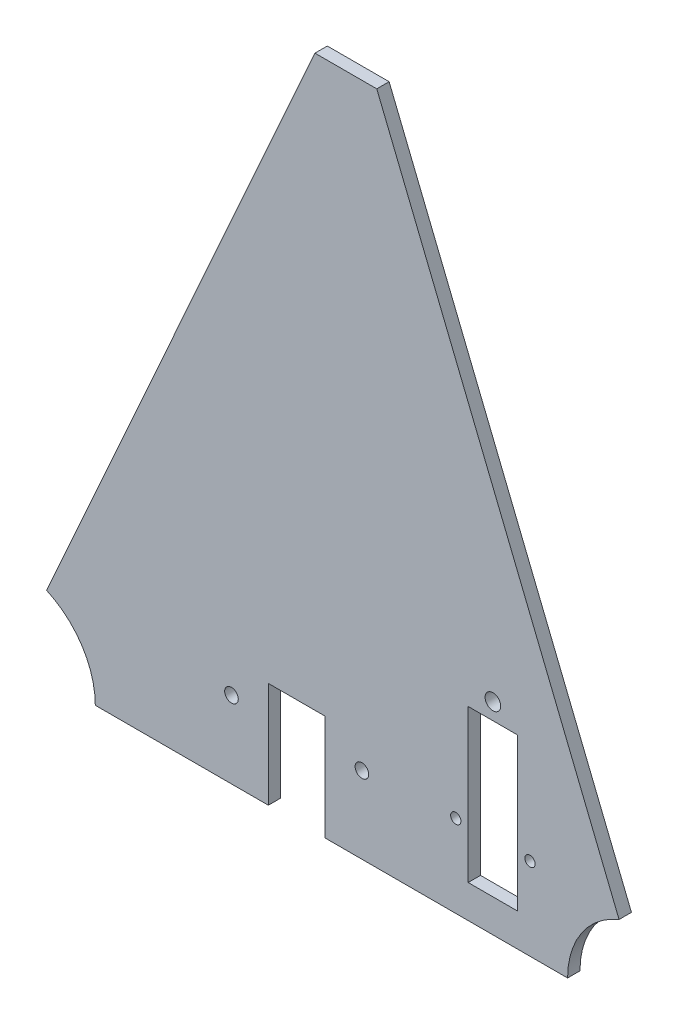
from build123d import *

# Parameters (mm, degrees)
BOSS_EXTRUDE1_DEPTH     = 7.62
SKETCH5_R               = 15.875
CUT_EXTRUDE2_DEPTH      = 50.8
SKETCH6_R               = 15.875
CUT_EXTRUDE3_DEPTH      = 50.8
CUT_EXTRUDE4_DEPTH      = 444.557362906
CUT_EXTRUDE4_DEPTH_BACK = 7.62
CUT_EXTRUDE6_REACH      = 445.557
SKETCH9_R               = 4.191
SKETCH10_W              = 30.48
SKETCH10_H              = 114.3
CUT_EXTRUDE12_DEPTH     = 25.4
CUT_EXTRUDE13_REACH     = 445.557
SKETCH13_R              = 4.826
CUT_EXTRUDE14_REACH     = 445.557
SKETCH14_R              = 50.8
CUT_EXTRUDE15_REACH     = 445.557
SKETCH15_R              = 50.8
SKETCH16_W              = 30.48
SKETCH16_H              = 20.32
BOSS_EXTRUDE2_DEPTH     = 7.62
CUT_EXTRUDE16_REACH     = 433.743
SKETCH17_R              = 3.175


with BuildPart() as part:
    # Sketch2 → Boss-Extrude1 (new body)
    with BuildSketch(Plane.XY):
        Polygon((-189.740054039, 245.383385713), (-375.90852523, -170.414614287), (16.77547477, -170.414614287), (-151.640054039, 245.383385713), align=None)
    extrude(amount=BOSS_EXTRUDE1_DEPTH)

    # Sketch5 → Cut-Extrude2 (cut)
    with BuildSketch(Plane(origin=(0, 0, 0), x_dir=(-1, 0, 0), z_dir=(0, 0, -1))):
        with Locations((375.90852523, -170.414614287)):
            Circle(SKETCH5_R)
    extrude(amount=-CUT_EXTRUDE2_DEPTH, mode=Mode.SUBTRACT)

    # Sketch6 → Cut-Extrude3 (cut)
    with BuildSketch(Plane(origin=(0, 0, 0), x_dir=(-1, 0, 0), z_dir=(0, 0, -1))):
        with Locations((-16.77547477, -170.414614287)):
            Circle(SKETCH6_R)
    extrude(amount=-CUT_EXTRUDE3_DEPTH, mode=Mode.SUBTRACT)

    # Sketch8 → Cut-Extrude4 (cut, two sides: drawn at the far end of the back side and taken through both)
    with BuildSketch(Plane(origin=(0, 0, 0), x_dir=(-1, 0, 0), z_dir=(0, 0, -1)).offset(-CUT_EXTRUDE4_DEPTH_BACK)):
        Polygon((218.448947474, -1130.046710402), (218.448947474, -170.414614287), (218.448947474, -105.390614287), (183.523947474, -105.390614287), (183.523947474, -170.414614287), (183.523947474, -1130.046710402), (183.523947474, -3049.310902633), (218.448947474, -3049.310902633), align=None)
    extrude(amount=CUT_EXTRUDE4_DEPTH + CUT_EXTRUDE4_DEPTH_BACK, mode=Mode.SUBTRACT)

    # Sketch9 → Cut-Extrude6 (cut, up to next)
    with BuildSketch(Plane(origin=(0, 0, 0), x_dir=(-1, 0, 0), z_dir=(0, 0, -1)), mode=Mode.PRIVATE) as cut_extrude6_sk1:
        with Locations((160.790947474, -123.043614287)):
            Circle(SKETCH9_R)
    cut_extrude6_tool1 = extrude(cut_extrude6_sk1.sketch, amount=-CUT_EXTRUDE6_REACH, mode=Mode.PRIVATE) & part.part
    # Sketch9 → Cut-Extrude6 (cut, up to next)
    with BuildSketch(Plane(origin=(0, 0, 0), x_dir=(-1, 0, 0), z_dir=(0, 0, -1)), mode=Mode.PRIVATE) as cut_extrude6_sk2:
        with Locations((241.181947474, -123.043614287)):
            Circle(SKETCH9_R)
    cut_extrude6_tool2 = extrude(cut_extrude6_sk2.sketch, amount=-CUT_EXTRUDE6_REACH, mode=Mode.PRIVATE) & part.part
    add(cut_extrude6_tool1.solids().sort_by_distance((-160.790947, -123.043614, 0))[0], mode=Mode.SUBTRACT)
    add(cut_extrude6_tool2.solids().sort_by_distance((-241.181947, -123.043614, 0))[0], mode=Mode.SUBTRACT)

    # Sketch10 → Cut-Extrude12 (cut)
    with BuildSketch(Plane(origin=(0, 0, 0), x_dir=(-1, 0, 0), z_dir=(0, 0, -1))):
        with Locations((80.066257047, -113.264614287)):
            Rectangle(SKETCH10_W, SKETCH10_H)
    extrude(amount=-CUT_EXTRUDE12_DEPTH, mode=Mode.SUBTRACT)

    # Sketch13 → Cut-Extrude13 (cut, up to next)
    with BuildSketch(Plane(origin=(0, 0, 0), x_dir=(-1, 0, 0), z_dir=(0, 0, -1)), mode=Mode.PRIVATE) as cut_extrude13_sk1:
        with Locations((80.066257047, -45.954614287)):
            Circle(SKETCH13_R)
    cut_extrude13_tool1 = extrude(cut_extrude13_sk1.sketch, amount=-CUT_EXTRUDE13_REACH, mode=Mode.PRIVATE) & part.part
    add(cut_extrude13_tool1.solids().sort_by_distance((-80.066257, -45.954614, 0))[0], mode=Mode.SUBTRACT)

    # Sketch14 → Cut-Extrude14 (cut, up to next)
    with BuildSketch(Plane(origin=(0, 0, 0), x_dir=(-1, 0, 0), z_dir=(0, 0, -1)), mode=Mode.PRIVATE) as cut_extrude14_sk1:
        with Locations((-16.77547477, -170.414614287)):
            Circle(SKETCH14_R)
    cut_extrude14_tool1 = extrude(cut_extrude14_sk1.sketch, amount=-CUT_EXTRUDE14_REACH, mode=Mode.PRIVATE) & part.part
    add(cut_extrude14_tool1.solids().sort_by_distance((16.775475, -170.414614, 0))[0], mode=Mode.SUBTRACT)

    # Sketch15 → Cut-Extrude15 (cut, up to next)
    with BuildSketch(Plane(origin=(0, 0, 0), x_dir=(-1, 0, 0), z_dir=(0, 0, -1)), mode=Mode.PRIVATE) as cut_extrude15_sk1:
        with Locations((375.90852523, -170.414614287)):
            Circle(SKETCH15_R)
    cut_extrude15_tool1 = extrude(cut_extrude15_sk1.sketch, amount=-CUT_EXTRUDE15_REACH, mode=Mode.PRIVATE) & part.part
    add(cut_extrude15_tool1.solids().sort_by_distance((-375.908525, -170.414614, 0))[0], mode=Mode.SUBTRACT)

    # Sketch16 → Boss-Extrude2 (add)
    with BuildSketch(Plane(origin=(0, 0, 0), x_dir=(-1, 0, 0), z_dir=(0, 0, -1))):
        with Locations((80.066257047, -160.254614287)):
            Rectangle(SKETCH16_W, SKETCH16_H)
    extrude(amount=-BOSS_EXTRUDE2_DEPTH)

    # Sketch17 → Cut-Extrude16 (cut, up to next)
    with BuildSketch(Plane(origin=(0, 0, 0), x_dir=(-1, 0, 0), z_dir=(0, 0, -1)), mode=Mode.PRIVATE) as cut_extrude16_sk1:
        with Locations((57.206257047, -119.614614287)):
            Circle(SKETCH17_R)
    cut_extrude16_tool1 = extrude(cut_extrude16_sk1.sketch, amount=-CUT_EXTRUDE16_REACH, mode=Mode.PRIVATE) & part.part
    # Sketch17 → Cut-Extrude16 (cut, up to next)
    with BuildSketch(Plane(origin=(0, 0, 0), x_dir=(-1, 0, 0), z_dir=(0, 0, -1)), mode=Mode.PRIVATE) as cut_extrude16_sk2:
        with Locations((102.926257047, -119.614614287)):
            Circle(SKETCH17_R)
    cut_extrude16_tool2 = extrude(cut_extrude16_sk2.sketch, amount=-CUT_EXTRUDE16_REACH, mode=Mode.PRIVATE) & part.part
    add(cut_extrude16_tool1.solids().sort_by_distance((-57.206257, -119.614614, 0))[0], mode=Mode.SUBTRACT)
    add(cut_extrude16_tool2.solids().sort_by_distance((-102.926257, -119.614614, 0))[0], mode=Mode.SUBTRACT)


solid = part.part
